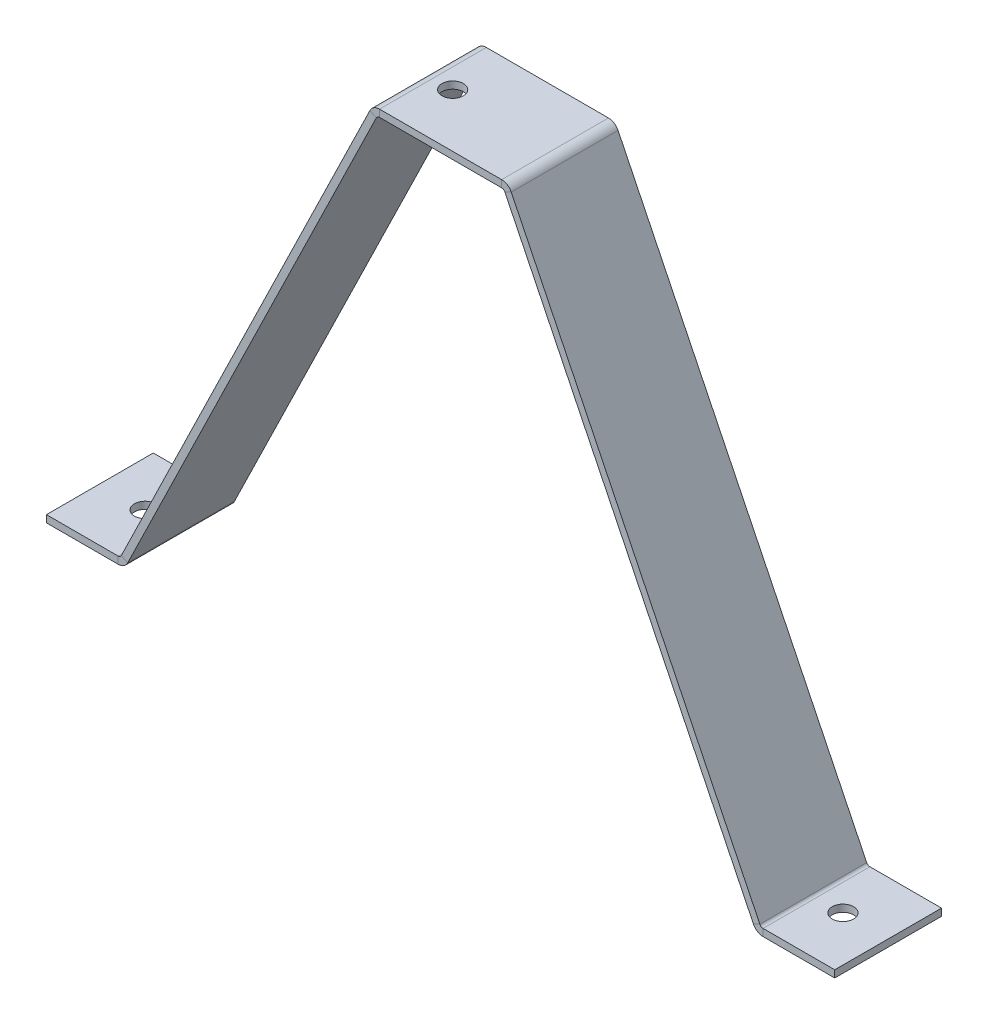
from build123d import *

# Parameters (mm, degrees)
SKETCH_1_W               = 20
SKETCH_1_H               = 15
EXTRUDE_1_DEPTH          = 1
SM_START                 = -7.5
SM_EDGE_FLANGE_2_DEPTH   = 15
SM_EDGE_FLANGE_2_2_DEPTH = 15
SM_EDGE_FLANGE_3_DEPTH   = 15
SM_EDGE_FLANGE_3_2_DEPTH = 15
SKETCH_27_R              = 1.5
CUT_EXTRUDE_1_DEPTH      = 5
SKETCH_28_R              = 1.5
CUT_EXTRUDE_2_DEPTH      = 10


# Read off the part's stored shape, not the designer's step: Ребро-кромка2, Ребро-кромка3
with BuildPart() as part:
    # Sketch 1 → Бобышка-Вытянуть1 (new body)
    with BuildSketch(Plane(origin=(0, 0, 0), x_dir=(1, 0, 0), z_dir=(0, 1, 0))):
        Rectangle(SKETCH_1_W, SKETCH_1_H)
    extrude(amount=EXTRUDE_1_DEPTH)

    # Ребро-кромка2 outline → Ребро-кромка2 (cut)
    with BuildSketch(Plane.XY.offset(SM_START)):
        with BuildLine():
            Line((-10, 0), (-9.923154453, 0.15755672))
            ThreePointArc((-9.923154453, 0.15755672), (-9.36984228, 0.772072144), (-8.574963384, 1))
            Line((-8.574963384, 1), (-10, 1))
            Line((-10, 1), (-10, 0))
        make_face()
        with BuildLine():
            Line((10, 1), (8.574963384, 1))
            ThreePointArc((8.574963384, 1), (9.36984228, 0.772072144), (9.923154453, 0.15755672))
            Line((9.923154453, 0.15755672), (10, 0))
            Line((10, 0), (10, 1))
        make_face()
    extrude(amount=SM_EDGE_FLANGE_2_DEPTH, mode=Mode.SUBTRACT)

    # Sm Edge Flange 2 2 outline → Sm Edge Flange 2 2 (add)
    with BuildSketch(Plane.XY.offset(SM_START)):
        with BuildLine():
            Line((-8.574963384, 0), (-10, 0))
            Line((-10, 0), (-45.458701448, -72.701111797))
            Line((-45.458701448, -72.701111797), (-44.559907402, -73.139482943))
            Line((-44.559907402, -73.139482943), (-9.024360407, -0.280814427))
            ThreePointArc((-9.024360407, -0.280814427), (-8.839923016, -0.075975952), (-8.574963384, 0))
        make_face()
        with BuildLine():
            Line((10, 0), (8.574963384, 0))
            ThreePointArc((8.574963384, 0), (8.839923016, -0.075975952), (9.024360407, -0.280814427))
            Line((9.024360407, -0.280814427), (44.559907402, -73.139482943))
            Line((44.559907402, -73.139482943), (45.458701448, -72.701111797))
            Line((45.458701448, -72.701111797), (10, 0))
        make_face()
    extrude(amount=SM_EDGE_FLANGE_2_2_DEPTH)

    # Ребро-кромка3 outline → Ребро-кромка3 (cut)
    with BuildSketch(Plane.XY.offset(SM_START)):
        with BuildLine():
            ThreePointArc((-43.935212466, -71.858668517), (-44.488524639, -72.473183941), (-45.283403536, -72.701111797))
            Line((-45.283403536, -72.701111797), (-45.458701448, -72.701111797))
            Line((-45.458701448, -72.701111797), (-44.559907402, -73.139482943))
            Line((-44.559907402, -73.139482943), (-43.935212466, -71.858668517))
        make_face()
        with BuildLine():
            Line((44.559907402, -73.139482943), (45.458701448, -72.701111797))
            Line((45.458701448, -72.701111797), (45.283403536, -72.701111797))
            ThreePointArc((45.283403536, -72.701111797), (44.488524639, -72.473183941), (43.935212466, -71.858668517))
            Line((43.935212466, -71.858668517), (44.559907402, -73.139482943))
        make_face()
    extrude(amount=SM_EDGE_FLANGE_3_DEPTH, mode=Mode.SUBTRACT)

    # Sm Edge Flange 3 2 outline → Sm Edge Flange 3 2 (add)
    with BuildSketch(Plane.XY.offset(SM_START)):
        with BuildLine():
            Line((-55.346099508, -72.701111797), (-45.458701448, -72.701111797))
            Line((-45.458701448, -72.701111797), (-44.834006512, -71.42029737))
            ThreePointArc((-44.834006512, -71.42029737), (-45.018443903, -71.625135845), (-45.283403536, -71.701111797))
            Line((-45.283403536, -71.701111797), (-55.346099508, -71.701111797))
            Line((-55.346099508, -71.701111797), (-55.346099508, -72.701111797))
        make_face()
        with BuildLine():
            Line((45.458701448, -72.701111797), (55.346099508, -72.701111797))
            Line((55.346099508, -72.701111797), (55.346099508, -71.701111797))
            Line((55.346099508, -71.701111797), (45.283403536, -71.701111797))
            ThreePointArc((45.283403536, -71.701111797), (45.018443903, -71.625135845), (44.834006512, -71.42029737))
            Line((44.834006512, -71.42029737), (45.458701448, -72.701111797))
        make_face()
    extrude(amount=SM_EDGE_FLANGE_3_2_DEPTH)

    # Эскиз27 → Вырез-Вытянуть1 (cut)
    with BuildSketch(Plane(origin=(0, -71.701111797, 0), x_dir=(1, 0, 0), z_dir=(0, 1, 0))):
        with Locations(Location((-48.996099508, 0, 0), (0, 0, 270))):
            Circle(SKETCH_27_R)
        with Locations(Location((48.996099508, 0, 0), (0, 0, 270))):
            Circle(SKETCH_27_R)
    extrude(amount=-CUT_EXTRUDE_1_DEPTH, mode=Mode.SUBTRACT)

    # Эскиз28 → Вырез-Вытянуть2 (cut)
    with BuildSketch(Plane(origin=(0, 1, 0), x_dir=(1, 0, 0), z_dir=(0, 1, 0))):
        with Locations(Location((-5.804963384, 0, 0), (0, 0, 270))):
            Circle(SKETCH_28_R)
    extrude(amount=-CUT_EXTRUDE_2_DEPTH, mode=Mode.SUBTRACT)


solid = part.part
